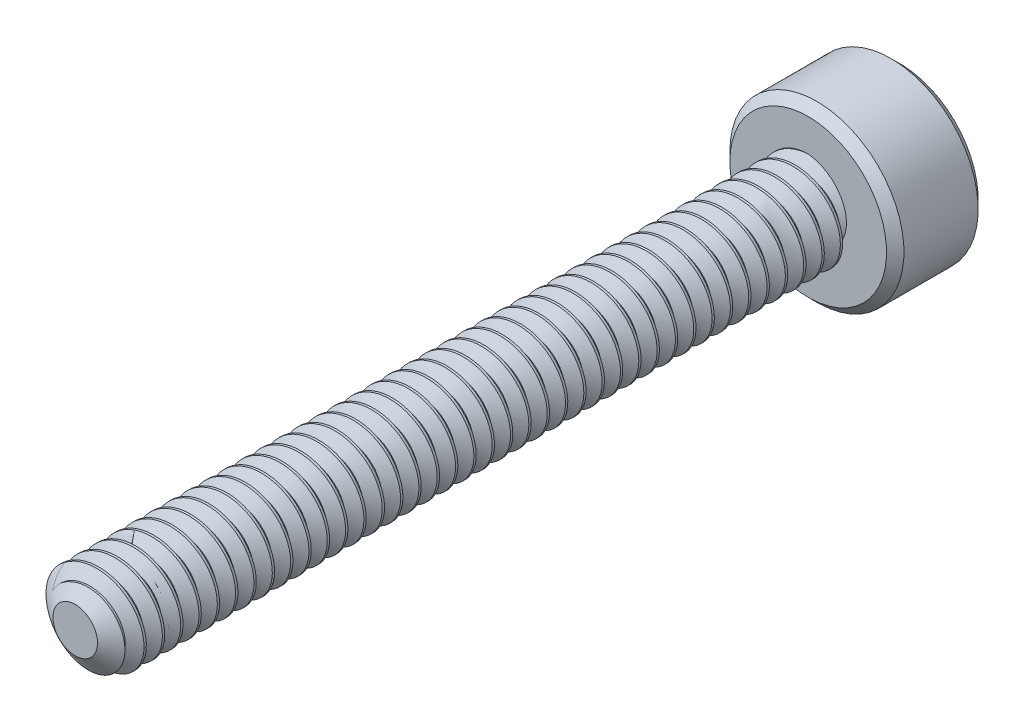
from build123d import *

# Parameters (mm, degrees)
SKETCH1_R          = 1
EXTRUDE1_DEPTH     = 16
CUT_SWEEP1_PITCH   = 0.4
SKETCH6_R          = 1.9
EXTRUDE2_DEPTH     = 2
CUT_EXTRUDE1_DEPTH = 1.125
CHAMFER1_SIZE      = 0.19


with BuildPart() as part:
    # Sketch1 → Extrude1 (new body)
    with BuildSketch(Plane.XY):
        Circle(SKETCH1_R)
    extrude(amount=-EXTRUDE1_DEPTH)

    # Cut-Sweep1: arcs per turn and ends read off the stored shape
    # Cut-Sweep1: the profile of Sketch3 profile screwed along a right-hand helix through 43 turns, 6 arcs to a turn; built about Z, then put on its axis
    cut_sweep1_z = Axis((0, 0, 0), (0, 0, 1))
    cut_sweep1_corners = [(1.0003, 0, -0.750173205), (0.740192379, 0, -0.6), (0.740192379, 0, -0.55), (1.0003, 0, -0.399826795)]
    with BuildLine(mode=Mode.PRIVATE) as cut_sweep1_profile:
        Line(cut_sweep1_corners[0], cut_sweep1_corners[1])
        Line(cut_sweep1_corners[1], cut_sweep1_corners[2])
        Line(cut_sweep1_corners[2], cut_sweep1_corners[3])
        Line(cut_sweep1_corners[3], cut_sweep1_corners[0])
    cut_sweep1_cap = Face(cut_sweep1_profile.wire())
    cut_sweep1_turn_angles = [0, 30, 60, 90, 120, 150, 180, 210, 240, 270, 300, 330, 360]
    cut_sweep1_turn_weights = [1, 0.8660254037844387, 1, 0.8660254037844387, 1, 0.8660254037844387, 1, 0.8660254037844387, 1, 0.8660254037844387, 1, 0.8660254037844387, 1]
    cut_sweep1_turn_rails = [Edge.make_bspline([Vector(p[0], p[1], 0).rotate(cut_sweep1_z, cut_sweep1_turn_angles[k]) / cut_sweep1_turn_weights[k] + Vector(0, 0, p[2] + CUT_SWEEP1_PITCH * cut_sweep1_turn_angles[k] / 360) for k in range(13)], [0, 0, 0, 1, 1, 2, 2, 3, 3, 4, 4, 5, 5, 6, 6, 6], 2, cut_sweep1_turn_weights) for p in cut_sweep1_corners]
    cut_sweep1_turn_sides = [Face.make_surface_from_curves(cut_sweep1_turn_rails[p[0]], cut_sweep1_turn_rails[p[1]]) for p in [(0, 1), (1, 2), (2, 3), (3, 0)]]
    cut_sweep1 = Plane(origin=(0, 0, 0), x_dir=(0, 1, 0), z_dir=(0, 0, -1)) * Solid(Shell([*[p.moved(Location((0, 0, CUT_SWEEP1_PITCH * i))) for i in range(43) for p in cut_sweep1_turn_sides], cut_sweep1_cap, cut_sweep1_cap.rotate(cut_sweep1_z, 15480).moved(Location((0, 0, CUT_SWEEP1_PITCH * 15480 / 360)))]))
    add(cut_sweep1, mode=Mode.SUBTRACT)

    # Sketch4 → Cut-Revolve1 (revolve, cut)
    with BuildSketch(Plane(origin=(0, 0, 0), x_dir=(0, 0, -1), z_dir=(1, 0, 0)), mode=Mode.PRIVATE) as cut_revolve1_sk:
        Polygon((0.35977197, 1), (0, 0.486192379), (0, 1), align=None)
    revolve(cut_revolve1_sk.sketch.rotate(Axis((0, 0, 0), (0, 0, -1)), 278.428757719), axis=Axis((0, 0, 0), (0, 0, -1)), mode=Mode.SUBTRACT)

    # Sketch6 → Extrude2 (add)
    with BuildSketch(Plane(origin=(0, 0, -16), x_dir=(-1, 0, 0), z_dir=(0, 0, -1))):
        Circle(SKETCH6_R)
    extrude(amount=EXTRUDE2_DEPTH)

    # Sketch7 → Cut-Extrude1 (cut)
    with BuildSketch(Plane(origin=(0, 0, -18), x_dir=(-1, 0, 0), z_dir=(0, 0, -1))):
        Polygon((0, 0.866025404), (-0.75, 0.433012702), (-0.75, -0.433012702), (0, -0.866025404), (0.75, -0.433012702), (0.75, 0.433012702), align=None)
    extrude(amount=-CUT_EXTRUDE1_DEPTH, mode=Mode.SUBTRACT)

    # Cut-Extrude2 cone 1 section (through the dimple's axis) → Cut-Extrude2 (revolve, cut)
    with BuildSketch(Plane(origin=(0, 0, -18), x_dir=(0, 1, 0), z_dir=(1, 0, 0))):
        Polygon((0, 0), (0.866025404, 0), (0, 0.866025404), align=None)
    revolve(axis=Axis((0, 0, -18), (0, 0, 1)), mode=Mode.SUBTRACT)

    # Chamfer1
    chamfer1_edges = [part.edges().sort_by_distance(p)[0] for p in [
        (1.9, 0, -16),
        (1.9, 0, -18),
    ]]
    chamfer(chamfer1_edges, length=CHAMFER1_SIZE)


solid = part.part
